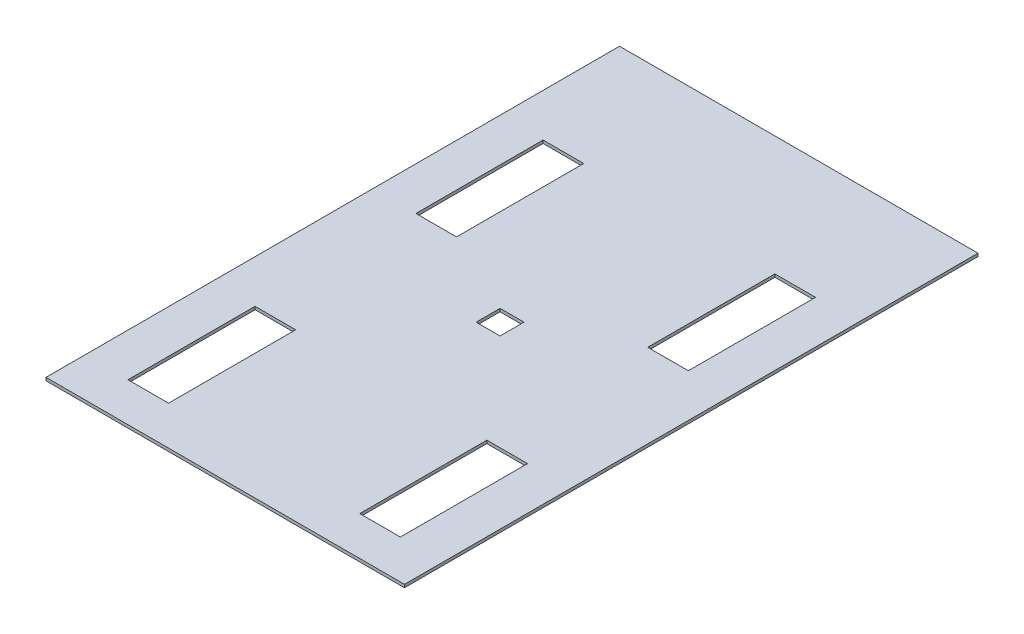
from build123d import *

# Parameters (mm, degrees)
SKETCH1_W           = 381
SKETCH1_H           = 609.6
BOSS_EXTRUDE1_DEPTH = 3.175
SKETCH2_W           = 43.18
SKETCH2_H           = 135.128
CUT_EXTRUDE1_DEPTH  = 360.448703746
SKETCH4_W           = 25.4
SKETCH4_H           = 25.4
CUT_EXTRUDE3_DEPTH  = 360.448703746


with BuildPart() as part:
    # Sketch1 → Boss-Extrude1 (new body)
    with BuildSketch(Plane(origin=(0, 0, 0), x_dir=(1, 0, 0), z_dir=(0, 1, 0))):
        Rectangle(SKETCH1_W, SKETCH1_H)
    extrude(amount=BOSS_EXTRUDE1_DEPTH)

    # Sketch2 → Cut-Extrude1 (cut, through all)
    with BuildSketch(Plane(origin=(0, 3.175, 0), x_dir=(1, 0, 0), z_dir=(0, 1, 0))):
        with Locations((123.19, -195.8594)):
            Rectangle(SKETCH2_W, SKETCH2_H)
        with Locations((123.19, 110.236)):
            Rectangle(SKETCH2_W, SKETCH2_H)
        with Locations((-123.19, -195.8594)):
            Rectangle(SKETCH2_W, SKETCH2_H)
        with Locations((-123.19, 110.236)):
            Rectangle(SKETCH2_W, SKETCH2_H)
    extrude(amount=-CUT_EXTRUDE1_DEPTH, mode=Mode.SUBTRACT)

    # Sketch4 → Cut-Extrude3 (cut, through all)
    with BuildSketch(Plane(origin=(0, 0, 0), x_dir=(1, 0, 0), z_dir=(0, 1, 0))):
        with Locations((0, -12.7)):
            Rectangle(SKETCH4_W, SKETCH4_H)
    extrude(amount=CUT_EXTRUDE3_DEPTH, mode=Mode.SUBTRACT)


solid = part.part
